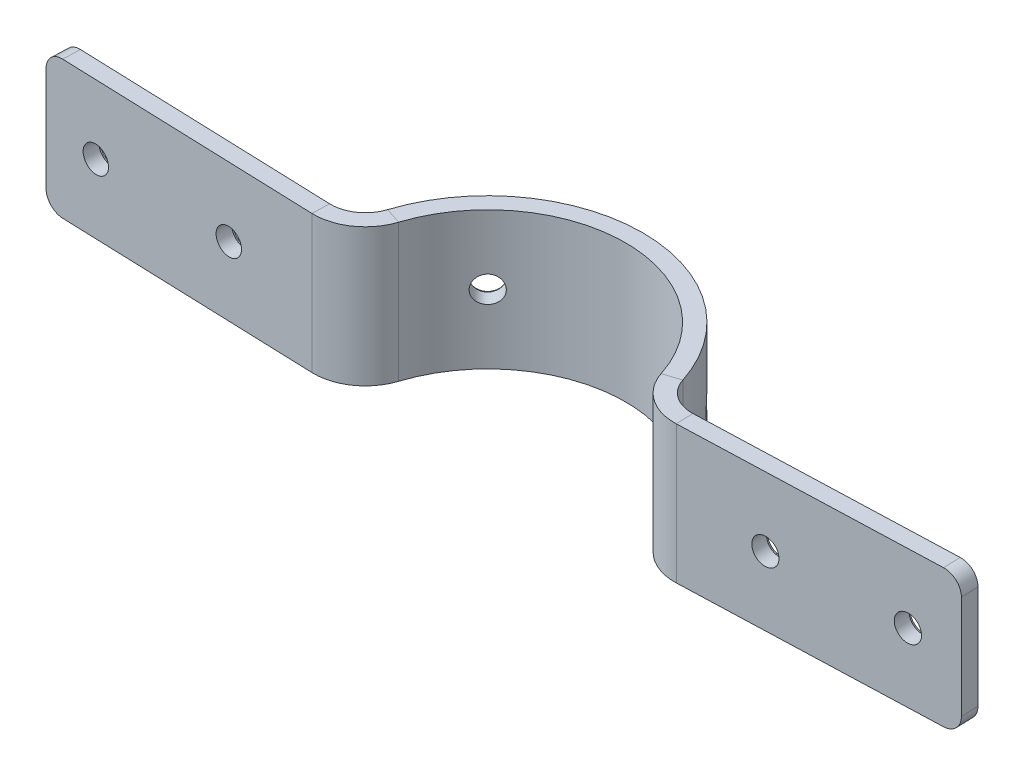
from build123d import *

# Parameters (mm, degrees)
BASE_FLANGE1_DEPTH                    = 12.7
F_11_0_191_DIAMETER_HOLE2_AT_2_COUNT  = 2
F_11_0_191_DIAMETER_HOLE2_AT_2_PITCH  = 25.4
F_11_0_191_DIAMETER_HOLE3_D           = 4.8514
F_11_0_191_DIAMETER_HOLE3_DEPTH       = 40.176204246
F_11_0_191_DIAMETER_HOLE3_CSINK_D     = 5.1562
F_11_0_191_DIAMETER_HOLE3_CSINK_ANGLE = 45
FILLET2_R                             = 3.175


# Sheet-metal steps are written as plain solids
with BuildPart() as part:
    # Sketch1 → Base-Flange1 (new, symmetric)
    with BuildSketch(Plane(origin=(0, 0, 0), x_dir=(1, 0, 0), z_dir=(0, 1, 0))):
        with BuildLine():
            Line((84.349626816, 2.945553875), (33.580572804, 1.172659442))
            ThreePointArc((33.580572804, 1.172659442), (27.77304054, 2.897708907), (24.180476435, 7.775896051))
            ThreePointArc((24.180476435, 7.775896051), (0, 25.4), (-24.180476435, 7.775896051))
            ThreePointArc((-24.180476435, 7.775896051), (-27.77304054, 2.897708907), (-33.580572804, 1.172659442))
            Line((-33.580572804, 1.172659442), (-84.349626816, 2.945553875))
            Line((-84.349626816, 2.945553875), (-84.238820914, 6.118619751))
            Line((-84.238820914, 6.118619751), (-33.469766902, 4.345725318))
            ThreePointArc((-33.469766902, 4.345725318), (-29.598078726, 5.495758295), (-27.203035989, 8.747883057))
            ThreePointArc((-27.203035989, 8.747883057), (0, 28.575), (27.203035989, 8.747883057))
            ThreePointArc((27.203035989, 8.747883057), (29.598078726, 5.495758295), (33.469766902, 4.345725318))
            Line((33.469766902, 4.345725318), (84.238820914, 6.118619751))
            Line((84.238820914, 6.118619751), (84.349626816, 2.945553875))
        make_face()
    extrude(amount=BASE_FLANGE1_DEPTH, both=True)

    # Sketch8 → #11 (0.191) Diameter Hole2 (revolve, cut)
    with BuildSketch(Plane(origin=(74.719623287, 0, -5.786202044), x_dir=(-0.9993908270190958, 0, 0.03489949670250169), z_dir=(0, 1, 0))):
        Polygon((0, 0), (0, 4.947848723), (2.4257, 4.947848723), (2.4257, 0.367926147), (2.5781, 0), align=None)
    f_11_0_191_diameter_hole2 = revolve(axis=Axis((74.498011483, 0, -12.132333796), (0.03489949670250171, 0, 0.9993908270190958)), mode=Mode.SUBTRACT)

    # #11 (0.191) Diameter Hole2 at 2: #11 (0.191) Diameter Hole2 ×2
    with Locations(*[Vector(-0.9993908270190958, 0, 0.034899496702501684) * (i * F_11_0_191_DIAMETER_HOLE2_AT_2_PITCH) for i in range(1, F_11_0_191_DIAMETER_HOLE2_AT_2_COUNT)]):
        add(f_11_0_191_diameter_hole2, mode=Mode.SUBTRACT)

    # #11 (0.191) Diameter Hole3
    with Locations(Plane(origin=(20.205576272, 0, -20.205576272), x_dir=(0.707106781187, 0, 0.707106781187), z_dir=(0.707106781187, 0, -0.707106781187))):
        with Locations((0, 0)):
            f_11_0_191_diameter_hole3 = CounterSinkHole(F_11_0_191_DIAMETER_HOLE3_D / 2, F_11_0_191_DIAMETER_HOLE3_CSINK_D / 2, depth=F_11_0_191_DIAMETER_HOLE3_DEPTH, counter_sink_angle=F_11_0_191_DIAMETER_HOLE3_CSINK_ANGLE)

    # Fillet2
    fillet2_edges = [part.edges().sort_by_distance(p)[0] for p in [
        (84.294223865, 12.7, -4.532086813),
        (-84.294223865, -12.7, -4.532086813),
        (84.294223865, -12.7, -4.532086813),
        (-84.294223865, 12.7, -4.532086813),
    ]]
    fillet(fillet2_edges, radius=FILLET2_R)

    # Mirror1: #11 (0.191) Diameter Hole2, #11 (0.191) Diameter Hole3 across plane
    add(f_11_0_191_diameter_hole2.mirror(Plane(origin=(0, 0, 0), x_dir=(0, 0, 1), z_dir=(1, 0, 0))), mode=Mode.SUBTRACT)
    add(f_11_0_191_diameter_hole3.mirror(Plane(origin=(0, 0, 0), x_dir=(0, 0, 1), z_dir=(1, 0, 0))), mode=Mode.SUBTRACT)

    # Mirror1 copy 1 sketch → Mirror1 copy 1 (revolve, cut)
    with BuildSketch(Plane(origin=(-49.335096281, 0, -4.899754828), x_dir=(0.9993908270190958, 0, 0.03489949670250169), z_dir=(0, 1, 0))):
        Polygon((0, 0), (0, -4.947848723), (2.4257, -4.947848723), (2.4257, -0.367926147), (2.5781, 0), align=None)
    revolve(axis=Axis((-49.113484477, 0, -11.24588658), (0.03489949670250171, 0, -0.9993908270190958)), mode=Mode.SUBTRACT)


solid = part.part
